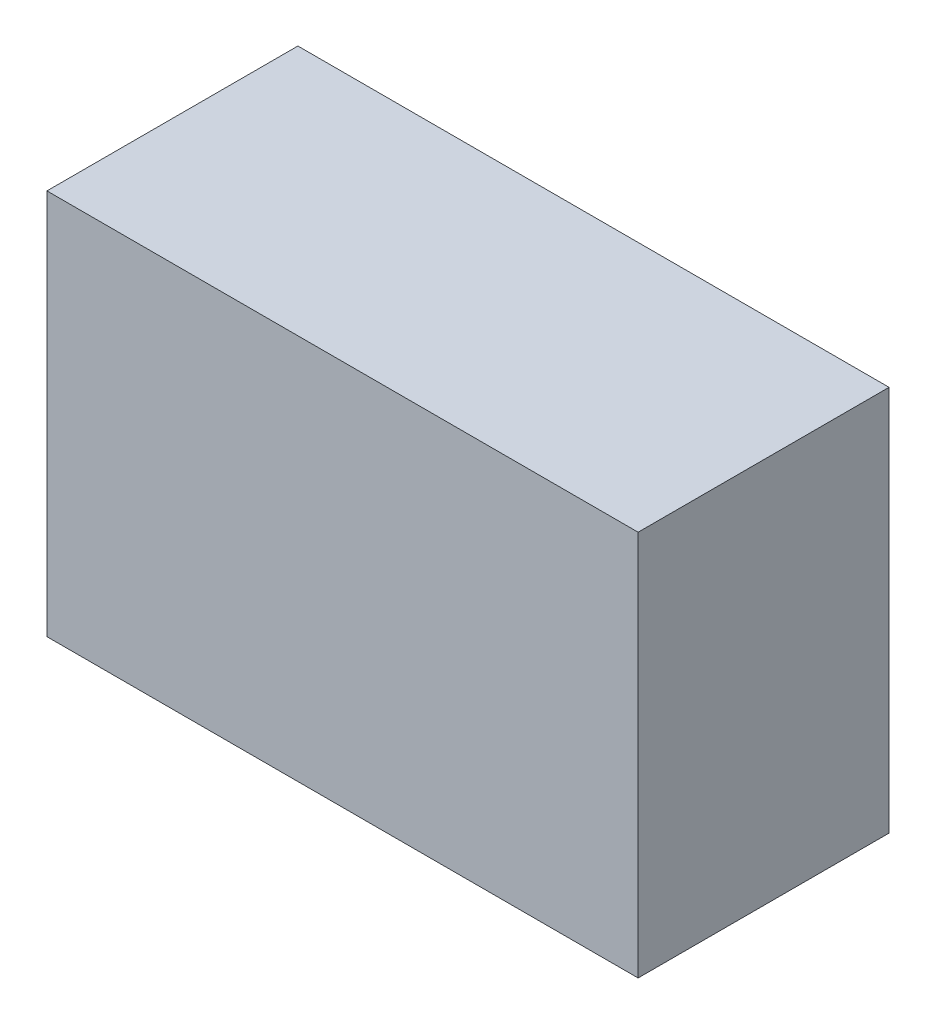
from build123d import *

# Parameters (mm, degrees)
SKETCH2_W      = 155.575
SKETCH2_H      = 66.04
EXTRUDE1_DEPTH = 101.6


with BuildPart() as part:
    # Sketch2 → Extrude1 (new body)
    with BuildSketch(Plane(origin=(0, 0, 0), x_dir=(1, 0, 0), z_dir=(0, 1, 0))):
        Rectangle(SKETCH2_W, SKETCH2_H)
    extrude(amount=EXTRUDE1_DEPTH)


solid = part.part
